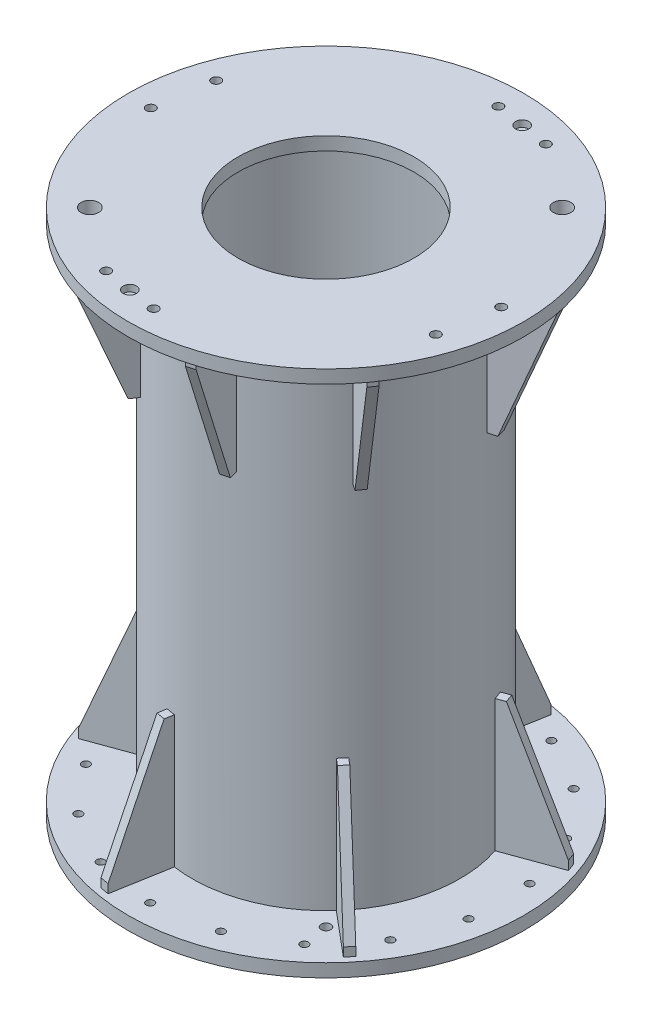
from build123d import *

# Parameters (mm, degrees)
SKETCH_1_R                  = 450
EXTRUDE_1_DEPTH             = 30
SKETCH_13_R                 = 305
SKETCH_13_R_2               = 285
EXTRUDE_1_2_DEPTH           = 1140
EXTRUDE_START               = 30
SKETCH_14_R                 = 450
EXTRUDE_2_DEPTH             = 30
CUT_EXTRUDE_6_REACH         = 1360.308
SKETCH_15_R                 = 9
PATTERN_CIRCULAR_6_COUNT    = 18
CUT_EXTRUDE_8_REACH         = 1360.308
SKETCH_32_R                 = 270
RIB_START                   = -10
RIB_25_DEPTH                = 20
PATTERN_CIRCULAR_13_COUNT   = 6
SKETCH_36_R                 = 11
CUT_EXTRUDE_10_DEPTH        = 1332.878372825
SKETCH_37_R                 = 200
CUT_EXTRUDE_11_DEPTH        = 30
HOLE_WIZARD_M24_2_D         = 21
HOLE_WIZARD_M24_2_DEPTH     = 63
HOLE_WIZARD_M24_2_TIP       = 6.3090365
HOLE_WIZARD_20_0_20_1_D     = 20
HOLE_WIZARD_20_0_20_1_DEPTH = 5
HOLE_WIZARD_20_0_20_1_TIP   = 6.00860619
SKETCH_44_R                 = 15
CUT_EXTRUDE_12_DEPTH        = 15
HOLE_WIZARD_M6_1_D          = 5
HOLE_WIZARD_M6_1_DEPTH      = 15
HOLE_WIZARD_M6_1_TIP        = 1.502151548
RIB_39_DEPTH                = 20
RIB_43_DEPTH                = 20
PATTERN_CIRCULAR_14_COUNT   = 4
CUT_EXTRUDE_13_REACH        = 1333.878
SKETCH_50_R                 = 20


# Read off the part's stored shape, not the designer's step: 筋25, 筋39, 筋43
with BuildPart() as part:
    # 草图1 → Extrude 1 (new body)
    with BuildSketch(Plane(origin=(0, 0, 0), x_dir=(1, 0, 0), z_dir=(0, 1, 0))):
        with Locations(Location((0, 0, 0), (0, 0, 270))):
            Circle(SKETCH_1_R)
    extrude(amount=EXTRUDE_1_DEPTH)

    # 草图13 → Extrude 1 2 (add)
    with BuildSketch(Plane.XZ):
        Circle(SKETCH_13_R)
        Circle(SKETCH_13_R_2, mode=Mode.SUBTRACT)
    extrude(amount=EXTRUDE_1_2_DEPTH)

    # 草图14 → 凸台-拉伸2 (add)
    with BuildSketch(Plane.XZ.offset(1140).offset(EXTRUDE_START)):
        with Locations(Location((0, 0, 0), (0, 0, 90))):
            Circle(SKETCH_14_R)
    extrude(amount=-EXTRUDE_2_DEPTH)

    # 草图15 → 切除-拉伸6 (cut, up to next)
    with BuildSketch(Plane.XZ.offset(1170), mode=Mode.PRIVATE) as cut_extrude_6_sk1:
        with Locations(Location((0, 400, 0), (0, 0, 270))):
            Circle(SKETCH_15_R)
    cut_extrude_6_tool1 = extrude(cut_extrude_6_sk1.sketch, amount=-CUT_EXTRUDE_6_REACH, mode=Mode.PRIVATE) & part.part
    cut_extrude_6 = cut_extrude_6_tool1.solids().sort_by_distance((0, -1170, 400))[0]
    add(cut_extrude_6, mode=Mode.SUBTRACT)

    # 阵列(圆周)6: 切除-拉伸6 ×18 about axis
    pattern_circular_6_axis = Axis((0, 0, 0), (0, 1, 0))
    for i in range(1, PATTERN_CIRCULAR_6_COUNT):
        add(cut_extrude_6.rotate(pattern_circular_6_axis, i * 360 / PATTERN_CIRCULAR_6_COUNT), mode=Mode.SUBTRACT)

    # 草图32 → 切除-拉伸8 (cut, up to next)
    with BuildSketch(Plane.XZ.offset(1170), mode=Mode.PRIVATE) as cut_extrude_8_sk1:
        with Locations(Location((0, 0, 0), (0, 0, 270))):
            Circle(SKETCH_32_R)
    cut_extrude_8_tool1 = extrude(cut_extrude_8_sk1.sketch, amount=-CUT_EXTRUDE_8_REACH, mode=Mode.PRIVATE) & part.part
    add(cut_extrude_8_tool1.solids().sort_by_distance((0, -1170, 0))[0], mode=Mode.SUBTRACT)

    # 筋25 outline → 筋25 (add)
    with BuildSketch(Plane(origin=(0, 0, 0), x_dir=(0, 1, 0), z_dir=(0.34202014332566977, 0, 0.939692620785908)).offset(RIB_START)):
        Polygon((-1120, 435), (-1140, 435), (-1140, 304), (-840, 304), (-840, 325), align=None)
    rib_25 = extrude(amount=RIB_25_DEPTH)

    # 阵列(圆周)13: 筋25 ×6 about axis
    pattern_circular_13_axis = Axis((0, 0, 0), (0, 1, 0))
    for i in range(1, PATTERN_CIRCULAR_13_COUNT):
        add(rib_25.rotate(pattern_circular_13_axis, i * 360 / PATTERN_CIRCULAR_13_COUNT))

    # 草图36 → 切除-拉伸10 (cut, through all)
    with BuildSketch(Plane(origin=(0, -1140, 0), x_dir=(1, 0, 0), z_dir=(0, 1, 0))):
        with Locations(Location((247.487373415, -247.487373415, 0), (0, 0, 270))):
            Circle(SKETCH_36_R)
    extrude(amount=-CUT_EXTRUDE_10_DEPTH, mode=Mode.SUBTRACT)

    # 草图37 → 切除-拉伸11 (cut)
    with BuildSketch(Plane(origin=(0, 30, 0), x_dir=(1, 0, 0), z_dir=(0, 1, 0))):
        with Locations(Location((0, 0, 0), (0, 0, 270))):
            Circle(SKETCH_37_R)
    extrude(amount=-CUT_EXTRUDE_11_DEPTH, mode=Mode.SUBTRACT)

    # M24 螺纹孔2
    with Locations(Plane(origin=(0, 30, 0), x_dir=(1, 0, 0), z_dir=(0, 1, 0))):
        with Locations((-125.209183504, -375.030212604), (3.190300773, -395.36669306), (-375.030212604, 125.209183504), (-395.36669306, -3.190300773), (375.030212604, -125.209183504), (395.36669306, 3.190300773), (125.209183504, 375.030212604), (-3.190300773, 395.36669306)):
            Hole(HOLE_WIZARD_M24_2_D / 2, depth=HOLE_WIZARD_M24_2_DEPTH)
            with Locations((0, 0, -(HOLE_WIZARD_M24_2_DEPTH + HOLE_WIZARD_M24_2_TIP / 2))):  # 118° drill point
                Cone(0, HOLE_WIZARD_M24_2_D / 2, HOLE_WIZARD_M24_2_TIP, mode=Mode.SUBTRACT)

    # Ø20.0 (20) 直径孔1
    with Locations(Plane(origin=(0, 30, 0), x_dir=(1, 0, 0), z_dir=(0, 1, 0))):
        with Locations((-61.009441366, -385.198452832), (61.009441366, 385.198452832)):
            Hole(HOLE_WIZARD_20_0_20_1_D / 2, depth=HOLE_WIZARD_20_0_20_1_DEPTH)
            with Locations((0, 0, -(HOLE_WIZARD_20_0_20_1_DEPTH + HOLE_WIZARD_20_0_20_1_TIP / 2))):  # 118° drill point
                Cone(0, HOLE_WIZARD_20_0_20_1_D / 2, HOLE_WIZARD_20_0_20_1_TIP, mode=Mode.SUBTRACT)

    # 草图44 → 切除-拉伸12 (cut)
    with BuildSketch(Plane(origin=(0, 30, 0), x_dir=(1, 0, 0), z_dir=(0, 1, 0))):
        with Locations(Location((61.009441366, 385.198452832, 0), (0, 0, 270))):
            Circle(SKETCH_44_R)
        with Locations(Location((-61.009441366, -385.198452832, 0), (0, 0, 270))):
            Circle(SKETCH_44_R)
    extrude(amount=-CUT_EXTRUDE_12_DEPTH, mode=Mode.SUBTRACT)

    # M6 螺纹孔1
    with Locations(Plane(origin=(0, 15, 0), x_dir=(1, 0, 0), z_dir=(0, 1, 0))):
        with Locations((61.009441366, 385.198452832), (-61.009441366, -385.198452832)):
            Hole(HOLE_WIZARD_M6_1_D / 2, depth=HOLE_WIZARD_M6_1_DEPTH)
            with Locations((0, 0, -(HOLE_WIZARD_M6_1_DEPTH + HOLE_WIZARD_M6_1_TIP / 2))):  # 118° drill point
                Cone(0, HOLE_WIZARD_M6_1_D / 2, HOLE_WIZARD_M6_1_TIP, mode=Mode.SUBTRACT)

    # 筋39 outline → 筋39 (add)
    with BuildSketch(Plane(origin=(0, 0, 0), x_dir=(0, 1, 0), z_dir=(0.9659258262890681, 0, -0.25881904510252135)).offset(RIB_START)):
        Polygon((0, 435), (-20, 435), (-300, 325), (-300, 304), (0, 304), align=None)
    rib_39 = extrude(amount=RIB_39_DEPTH)

    # 筋43 outline → 筋43 (add)
    with BuildSketch(Plane(origin=(0, 0, 0), x_dir=(0, 1, 0), z_dir=(0.8191520442889991, 0, 0.5735764363510355)).offset(RIB_START)):
        Polygon((-300, 325), (-300, 304), (0, 304), (0, 435), (-20, 435), align=None)
    rib_43 = extrude(amount=RIB_43_DEPTH)

    # 阵列(圆周)14: 筋39, 筋43 ×4 about axis
    pattern_circular_14_axis = Axis((0, 0, 0), (0, 1, 0))
    add([rib_39.rotate(pattern_circular_14_axis, i * 360 / PATTERN_CIRCULAR_14_COUNT) for i in range(1, PATTERN_CIRCULAR_14_COUNT)])
    add([rib_43.rotate(pattern_circular_14_axis, i * 360 / PATTERN_CIRCULAR_14_COUNT) for i in range(1, PATTERN_CIRCULAR_14_COUNT)])

    # 草图50 → 切除-拉伸13 (cut, up to next)
    with BuildSketch(Plane.XZ, mode=Mode.PRIVATE) as cut_extrude_13_sk1:
        with Locations(Location((-268.700576851, 268.700576851, 0), (0, 0, 270))):
            Circle(SKETCH_50_R)
    cut_extrude_13_tool1 = extrude(cut_extrude_13_sk1.sketch, amount=-CUT_EXTRUDE_13_REACH, mode=Mode.PRIVATE) & part.part
    # 草图50 → 切除-拉伸13 (cut, up to next)
    with BuildSketch(Plane.XZ, mode=Mode.PRIVATE) as cut_extrude_13_sk2:
        with Locations(Location((268.700576851, -268.700576851, 0), (0, 0, 270))):
            Circle(SKETCH_50_R)
    cut_extrude_13_tool2 = extrude(cut_extrude_13_sk2.sketch, amount=-CUT_EXTRUDE_13_REACH, mode=Mode.PRIVATE) & part.part
    add(cut_extrude_13_tool1.solids().sort_by_distance((-268.700577, 0, 268.700577))[0], mode=Mode.SUBTRACT)
    add(cut_extrude_13_tool2.solids().sort_by_distance((268.700577, 0, -268.700577))[0], mode=Mode.SUBTRACT)


solid = part.part
